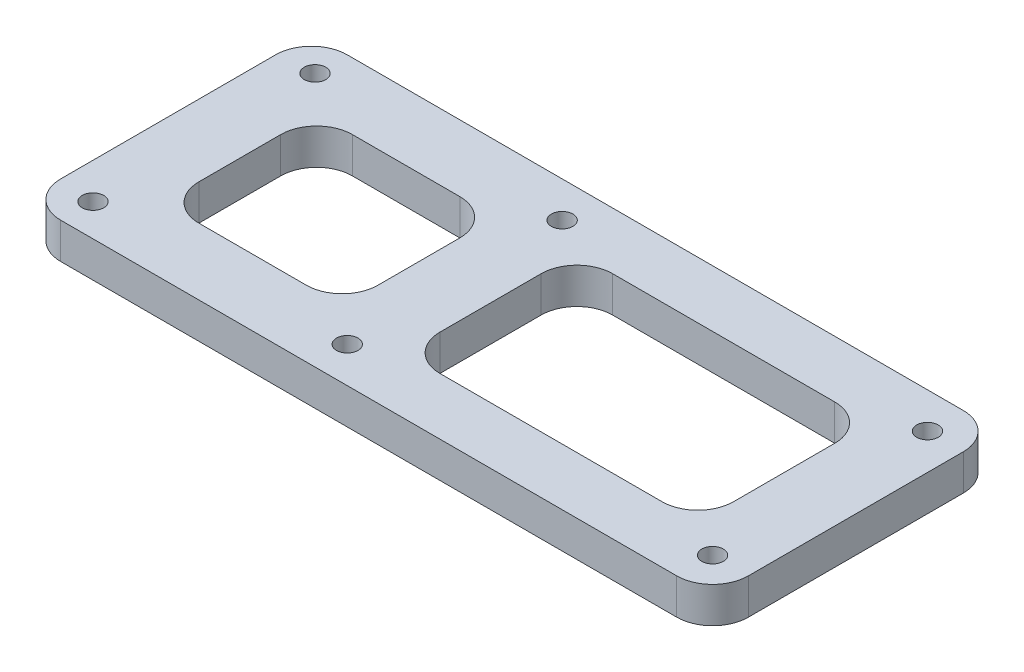
from build123d import *

# Parameters (mm, degrees)
SKETCH1_W           = 96
SKETCH1_H           = 40
SKETCH1_R           = 1.5
SKETCH1_W_2         = 41
SKETCH1_H_2         = 24.117647058
BOSS_EXTRUDE1_DEPTH = 5
FILLET1_R           = 5


with BuildPart() as part:
    # Sketch1 → Boss-Extrude1 (new body)
    with BuildSketch(Plane(origin=(0, 0, 0), x_dir=(1, 0, 0), z_dir=(0, 1, 0))):
        with Locations((8, 0)):
            Rectangle(SKETCH1_W, SKETCH1_H)
        with Locations((0, 15)):
            Circle(SKETCH1_R, mode=Mode.SUBTRACT)
        with Locations((25.5, 0)):
            Rectangle(SKETCH1_W_2, SKETCH1_H_2, mode=Mode.SUBTRACT)
        with Locations((-35, -15.5)):
            Circle(SKETCH1_R, mode=Mode.SUBTRACT)
        with Locations((-35, 15.5)):
            Circle(SKETCH1_R, mode=Mode.SUBTRACT)
        Polygon((-30, -10.714285714), (-30, 10.714285714), (-5, 10.714285714), (-5, -10.714285714), (-29.508196721, -10.714285714), align=None, mode=Mode.SUBTRACT)
        with Locations((0, -15)):
            Circle(SKETCH1_R, mode=Mode.SUBTRACT)
        with Locations((51, -15)):
            Circle(SKETCH1_R, mode=Mode.SUBTRACT)
        with Locations((51, 15)):
            Circle(SKETCH1_R, mode=Mode.SUBTRACT)
    extrude(amount=BOSS_EXTRUDE1_DEPTH)

    # Fillet1
    fillet1_edges = [part.edges().sort_by_distance(p)[0] for p in [
        (46, 2.5, 12.058823529),
        (5, 2.5, 12.058823529),
        (46, 2.5, -12.058823529),
        (5, 2.5, -12.058823529),
        (-5, 2.5, 10.714285714),
        (-30, 2.5, 10.714285714),
        (-5, 2.5, -10.714285714),
        (-30, 2.5, -10.714285714),
        (56, 2.5, -20),
        (56, 2.5, 20),
        (-40, 2.5, 20),
        (-40, 2.5, -20),
    ]]
    fillet(fillet1_edges, radius=FILLET1_R)


solid = part.part
